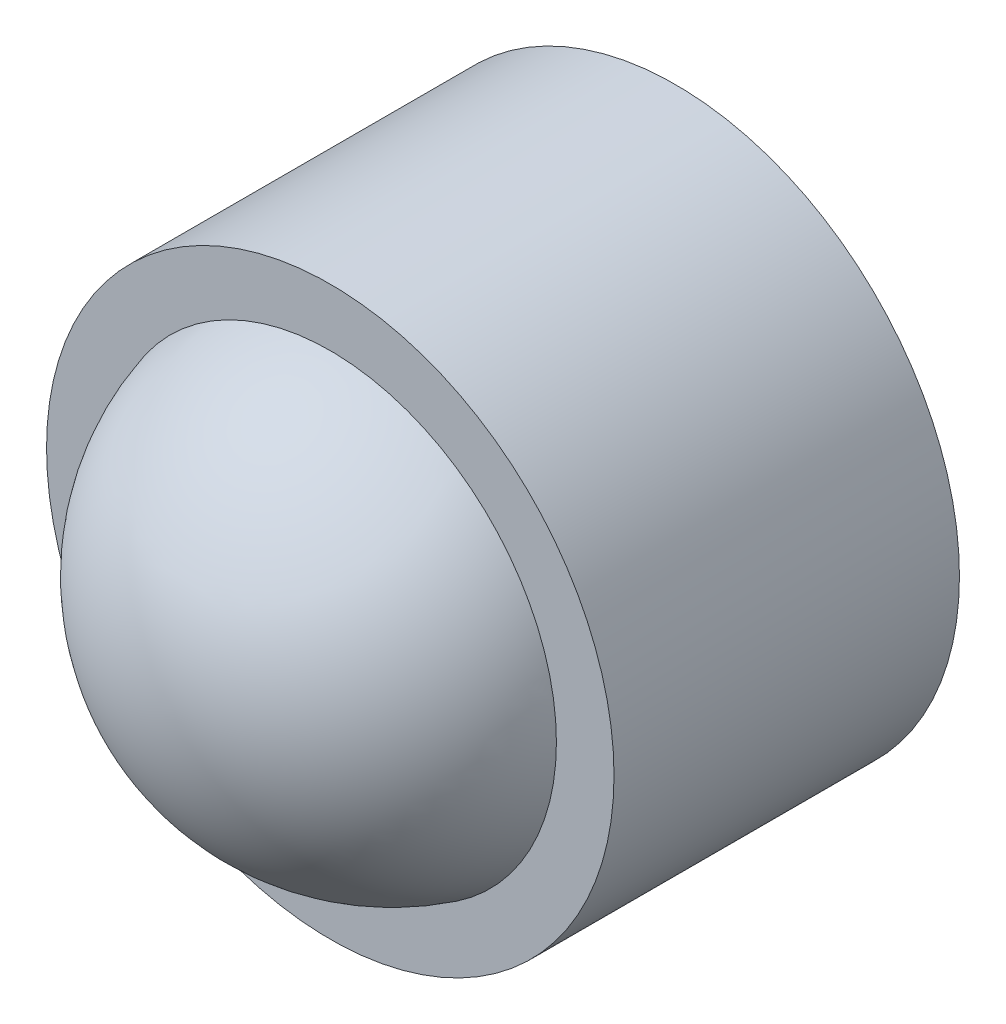
from build123d import *

# Parameters (mm, degrees)
SKIZZE1_R   = 11.5
SKIZZE1_R_2 = 1
BODY_DEPTH  = 14


with BuildPart() as part:
    # Skizze1 → Body (new body)
    with BuildSketch(Plane.XY):
        Circle(SKIZZE1_R)
        with Locations((-8, 0)):
            Circle(SKIZZE1_R_2, mode=Mode.SUBTRACT)
        with Locations((8, 0)):
            Circle(SKIZZE1_R_2, mode=Mode.SUBTRACT)
    extrude(amount=BODY_DEPTH)

    # Skizze2 → Rotation1 (revolve)
    with BuildSketch(Plane(origin=(0, 0, 0), x_dir=(1, 0, 0), z_dir=(0, 1, 0))):
        with BuildLine():
            ThreePointArc((0, -2), (-9.5, -11.5), (0, -21))
            Line((0, -21), (0, -2))
        make_face()
    revolve(axis=Axis((0, 0, 0), (0, 0, 1)))


solid = part.part
